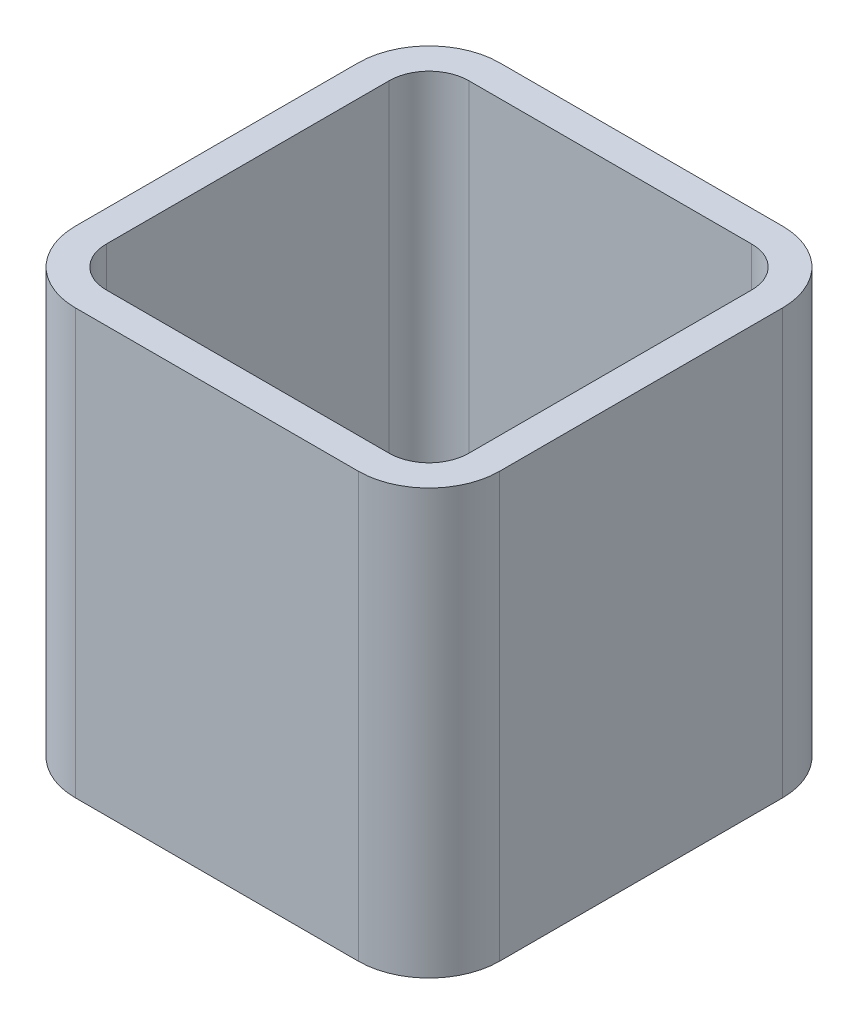
from build123d import *

# Parameters (mm, degrees)
EXTRUDE_THIN1_DEPTH = 304.8


with BuildPart() as part:
    # Sketch2 → Extrude-Thin1 (new body)
    with BuildSketch(Plane(origin=(0, 0, 0), x_dir=(1, 0, 0), z_dir=(0, 1, 0))):
        with BuildLine():
            Line((-101.6, 152.4), (101.6, 152.4))
            ThreePointArc((101.6, 152.4), (137.521024484, 137.521024484), (152.4, 101.6))
            Line((152.4, 101.6), (152.4, -101.6))
            ThreePointArc((152.4, -101.6), (137.521024484, -137.521024484), (101.6, -152.4))
            Line((101.6, -152.4), (-101.6, -152.4))
            ThreePointArc((-101.6, -152.4), (-137.521024484, -137.521024484), (-152.4, -101.6))
            Line((-152.4, -101.6), (-152.4, 101.6))
            ThreePointArc((-152.4, 101.6), (-137.521024484, 137.521024484), (-101.6, 152.4))
        make_face()
        with BuildLine():
            Line((-101.6, 130.175), (101.6, 130.175))
            ThreePointArc((101.6, 130.175), (121.805576272, 121.805576272), (130.175, 101.6))
            Line((130.175, 101.6), (130.175, -101.6))
            ThreePointArc((130.175, -101.6), (121.805576272, -121.805576272), (101.6, -130.175))
            Line((101.6, -130.175), (-101.6, -130.175))
            ThreePointArc((-101.6, -130.175), (-121.805576272, -121.805576272), (-130.175, -101.6))
            Line((-130.175, -101.6), (-130.175, 101.6))
            ThreePointArc((-130.175, 101.6), (-121.805576272, 121.805576272), (-101.6, 130.175))
        make_face(mode=Mode.SUBTRACT)
    extrude(amount=EXTRUDE_THIN1_DEPTH)


solid = part.part
